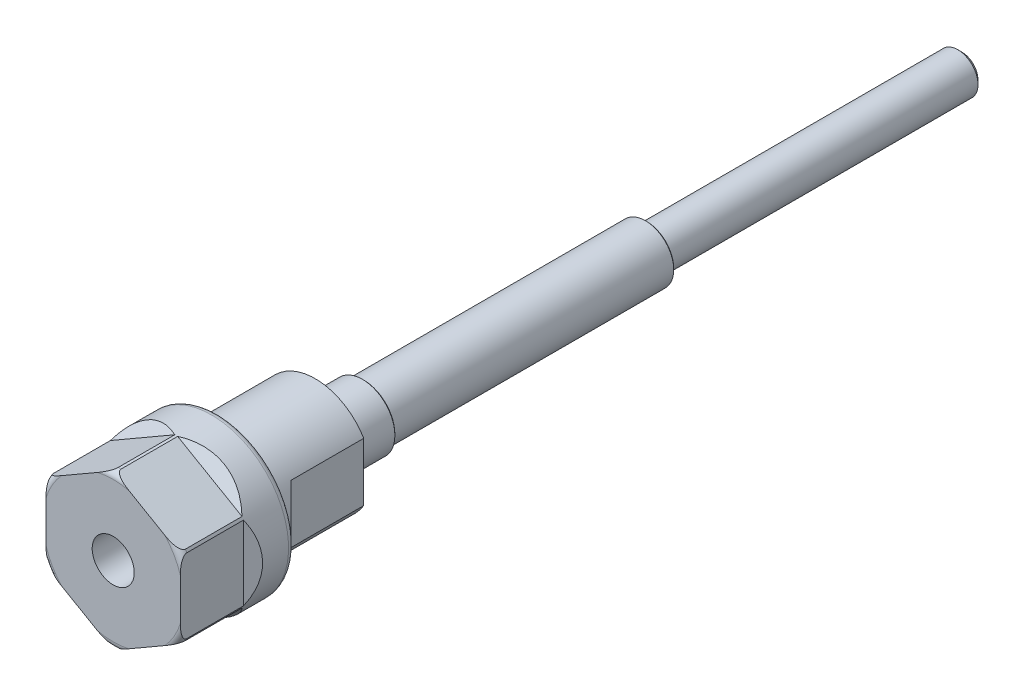
from build123d import *

# Parameters (mm, degrees)
ESQUISSE1_R         = 4
BOSS_EXTRU_1_DEPTH  = 80
SKETCH5_OUTSIDE_W   = 26.16
SKETCH5_OUTSIDE_H   = 26.16
SKETCH5_OUTSIDE_R   = 2.5
CUT_EXTRUDE6_DEPTH  = 39
CHAMFER4_SIZE       = 0.5
SKETCH6_OUTSIDE_W   = 26.16
SKETCH6_OUTSIDE_H   = 26.16
SKETCH6_OUTSIDE_R   = 3.5
CUT_EXTRUDE7_DEPTH  = 74
CHAMFER5_SIZE       = 0.15
ESQUISSE2_R         = 9.5
BOSS_EXTRU_2_DEPTH  = 25
CHANFREIN1_SIZE     = 1
SKETCH1_OUTSIDE_W   = 42.676
SKETCH1_OUTSIDE_H   = 42.676
SKETCH1_OUTSIDE_R   = 7
CUT_EXTRUDE1_DEPTH  = 12
SKETCH2_OUTSIDE_W   = 42.676
SKETCH2_OUTSIDE_H   = 42.676
SKETCH2_OUTSIDE_W_2 = 12
SKETCH2_OUTSIDE_H_2 = 19.946926602
CUT_EXTRUDE3_DEPTH  = 10
CHAMFER1_SIZE       = 1
FILLET1_R           = 0.8
SKETCH3_R           = 2.6
CUT_EXTRUDE4_DEPTH  = 12
SKETCH4_OUTSIDE_W   = 42.676
SKETCH4_OUTSIDE_H   = 42.676
CUT_EXTRUDE5_DEPTH  = 9
CHAMFER2_SIZE       = 1.2


# Some blends are built 0.0001 mm under size
with BuildPart() as part:
    # Esquisse1 → Boss.-Extru.1 (new body)
    with BuildSketch(Plane.XY):
        Circle(ESQUISSE1_R)
    extrude(amount=BOSS_EXTRU_1_DEPTH)

    # Sketch5 outside → Cut-Extrude6 (cut)
    with BuildSketch(Plane(origin=(0, 0, 0), x_dir=(-1, 0, 0), z_dir=(0, 0, -1))):
        Rectangle(SKETCH5_OUTSIDE_W, SKETCH5_OUTSIDE_H)
        Circle(SKETCH5_OUTSIDE_R, mode=Mode.SUBTRACT)
    extrude(amount=-CUT_EXTRUDE6_DEPTH, mode=Mode.SUBTRACT)

    # Chamfer4
    chamfer4_edges = [part.edges().sort_by_distance(p)[0] for p in [
        (2.5, 0, 0),
        (-4, 0, 39),
    ]]
    chamfer(chamfer4_edges, length=CHAMFER4_SIZE)

    # Sketch6 outside → Cut-Extrude7 (cut)
    with BuildSketch(Plane(origin=(0, 0, 0), x_dir=(-1, 0, 0), z_dir=(0, 0, -1))):
        Rectangle(SKETCH6_OUTSIDE_W, SKETCH6_OUTSIDE_H)
        with Locations(Location((0, 0, 0), (0, 0, 180))):
            Circle(SKETCH6_OUTSIDE_R, mode=Mode.SUBTRACT)
    extrude(amount=-CUT_EXTRUDE7_DEPTH, mode=Mode.SUBTRACT)

    # Chamfer5
    chamfer5_edges = [part.edges().sort_by_distance(p)[0] for p in [
        (-4, 0, 74),
        (-3.5, 0, 39),
    ]]
    chamfer(chamfer5_edges, length=CHAMFER5_SIZE)

    # Esquisse2 → Boss.-Extru.2 (add)
    with BuildSketch(Plane.XY.offset(80)):
        Circle(ESQUISSE2_R)
    extrude(amount=BOSS_EXTRU_2_DEPTH)

    # Chanfrein1
    chanfrein1_edges = [part.edges().sort_by_distance(p)[0] for p in [
        (-9.5, 0, 80),
    ]]
    chamfer(chanfrein1_edges, length=CHANFREIN1_SIZE)

    # Sketch1 outside → Cut-Extrude1 (cut)
    with BuildSketch(Plane(origin=(0, 0, 80), x_dir=(-1, 0, 0), z_dir=(0, 0, -1))):
        Rectangle(SKETCH1_OUTSIDE_W, SKETCH1_OUTSIDE_H)
        Circle(SKETCH1_OUTSIDE_R, mode=Mode.SUBTRACT)
    extrude(amount=-CUT_EXTRUDE1_DEPTH, mode=Mode.SUBTRACT)

    # Sketch2 outside → Cut-Extrude3 (cut)
    with BuildSketch(Plane(origin=(0, 0, 80), x_dir=(-1, 0, 0), z_dir=(0, 0, -1))):
        Rectangle(SKETCH2_OUTSIDE_W, SKETCH2_OUTSIDE_H)
        Rectangle(SKETCH2_OUTSIDE_W_2, SKETCH2_OUTSIDE_H_2, mode=Mode.SUBTRACT)
    extrude(amount=-CUT_EXTRUDE3_DEPTH, mode=Mode.SUBTRACT)

    # Chamfer1
    chamfer1_edges = [part.edges().sort_by_distance(p)[0] for p in [
        (-6, 0, 90),
        (6, 0, 90),
    ]]
    chamfer(chamfer1_edges, length=CHAMFER1_SIZE - 0.0001)  # a hair under: the kernel refuses the full size

    # Fillet1
    fillet1_edges = [part.edges().sort_by_distance(p)[0] for p in [
        (-9.5, 0, 105),
        (-9.5, 0, 92),
    ]]
    fillet(fillet1_edges, radius=FILLET1_R)

    # Sketch3 → Cut-Extrude4 (cut)
    with BuildSketch(Plane.XY.offset(105)):
        Circle(SKETCH3_R)
    extrude(amount=-CUT_EXTRUDE4_DEPTH, mode=Mode.SUBTRACT)

    # Sketch4 outside → Cut-Extrude5 (cut)
    with BuildSketch(Plane.XY.offset(105)):
        Rectangle(SKETCH4_OUTSIDE_W, SKETCH4_OUTSIDE_H)
        Polygon((0, 9.6), (-8.313843876, 4.8), (-8.313843876, -4.8), (0, -9.6), (8.313843876, -4.8), (8.313843876, 4.8), align=None, mode=Mode.SUBTRACT)
    extrude(amount=-CUT_EXTRUDE5_DEPTH, mode=Mode.SUBTRACT)

    # Chamfer2
    # the kernel refuses this chamfer: 1.2 mm, written as the material it adds along each edge
    with BuildSketch(Plane(origin=(10.810385156, 3.35862122, 96), x_dir=(-0.013747938305293243, -0.023812127644090277, 0.9996219169112968), z_dir=(-0.8660254037844388, 0.4999999999999998, 0))) as chamfer2_piece_1_section:
        Polygon((CHAMFER2_SIZE * 0.999621916911, CHAMFER2_SIZE * 0.0274958766106), (-CHAMFER2_SIZE * 0.0274958766106, CHAMFER2_SIZE * 0.999621916911), (0, 0), align=None)
    chamfer2_piece_1 = extrude(amount=15.365515119, mode=Mode.PRIVATE)
    chamfer2_piece_1 = chamfer2_piece_1 & Plane(origin=(0, 0, 96.431113377), x_dir=(1, 0, 0), z_dir=(0, 0, -1)) * Cylinder(9.5, 36, mode=Mode.PRIVATE)
    add(chamfer2_piece_1)
    with BuildSketch(Plane(origin=(8.313843876, -7.682757559, 96), x_dir=(0.9996219169112968, 0, -0.027495876610584506), z_dir=(0, 1, 0))) as chamfer2_piece_2_section:
        Polygon((CHAMFER2_SIZE * 0.999621916911, -CHAMFER2_SIZE * 0.0274958766106), (-CHAMFER2_SIZE * 0.0274958766106, -CHAMFER2_SIZE * 0.999621916911), (0, 0), align=None)
    chamfer2_piece_2 = extrude(amount=15.365515119, mode=Mode.PRIVATE)
    chamfer2_piece_2 = chamfer2_piece_2 & Plane(origin=(0, 0, 96.431113393), x_dir=(1, 0, 0), z_dir=(0, 0, -1)) * Cylinder(9.5, 36, mode=Mode.PRIVATE)
    add(chamfer2_piece_2)
    with BuildSketch(Plane(origin=(-2.496541279, -11.04137878, 96), x_dir=(-0.013747938305293143, 0.023812127644090086, 0.9996219169112968), z_dir=(0.8660254037844386, 0.5000000000000001, 0))) as chamfer2_piece_3_section:
        Polygon((CHAMFER2_SIZE * 0.999621916911, CHAMFER2_SIZE * 0.0274958766106), (-CHAMFER2_SIZE * 0.0274958766106, CHAMFER2_SIZE * 0.999621916911), (0, 0), align=None)
    chamfer2_piece_3 = extrude(amount=15.365515119, mode=Mode.PRIVATE)
    chamfer2_piece_3 = chamfer2_piece_3 & Plane(origin=(0, 0, 96.431113377), x_dir=(1, 0, 0), z_dir=(0, 0, -1)) * Cylinder(9.5, 36, mode=Mode.PRIVATE)
    add(chamfer2_piece_3)
    with BuildSketch(Plane(origin=(-10.810385156, -3.35862122, 96), x_dir=(0.013747938305293137, 0.023812127644090093, 0.9996219169112968), z_dir=(0.8660254037844387, -0.49999999999999983, 0))) as chamfer2_piece_4_section:
        Polygon((CHAMFER2_SIZE * 0.999621916911, CHAMFER2_SIZE * 0.0274958766106), (-CHAMFER2_SIZE * 0.0274958766106, CHAMFER2_SIZE * 0.999621916911), (0, 0), align=None)
    chamfer2_piece_4 = extrude(amount=15.365515119, mode=Mode.PRIVATE)
    chamfer2_piece_4 = chamfer2_piece_4 & Plane(origin=(0, 0, 96.431113377), x_dir=(1, 0, 0), z_dir=(0, 0, -1)) * Cylinder(9.5, 36, mode=Mode.PRIVATE)
    add(chamfer2_piece_4)
    with BuildSketch(Plane(origin=(-8.313843876, 7.682757559, 96), x_dir=(0.027495876610585904, 0, 0.9996219169112968), z_dir=(0, -1, 0))) as chamfer2_piece_5_section:
        Polygon((CHAMFER2_SIZE * 0.999621916911, CHAMFER2_SIZE * 0.0274958766106), (-CHAMFER2_SIZE * 0.0274958766106, CHAMFER2_SIZE * 0.999621916911), (0, 0), align=None)
    chamfer2_piece_5 = extrude(amount=15.365515119, mode=Mode.PRIVATE)
    chamfer2_piece_5 = chamfer2_piece_5 & Plane(origin=(0, 0, 96.431113377), x_dir=(1, 0, 0), z_dir=(0, 0, -1)) * Cylinder(9.5, 36, mode=Mode.PRIVATE)
    add(chamfer2_piece_5)
    with BuildSketch(Plane(origin=(2.496541279, 11.04137878, 96), x_dir=(0.013747938305292966, -0.023812127644089773, 0.9996219169112968), z_dir=(-0.8660254037844386, -0.5000000000000001, 0))) as chamfer2_piece_6_section:
        Polygon((CHAMFER2_SIZE * 0.999621916911, CHAMFER2_SIZE * 0.0274958766106), (-CHAMFER2_SIZE * 0.0274958766106, CHAMFER2_SIZE * 0.999621916911), (0, 0), align=None)
    chamfer2_piece_6 = extrude(amount=15.365515119, mode=Mode.PRIVATE)
    chamfer2_piece_6 = chamfer2_piece_6 & Plane(origin=(0, 0, 96.431113377), x_dir=(1, 0, 0), z_dir=(0, 0, -1)) * Cylinder(9.5, 36, mode=Mode.PRIVATE)
    add(chamfer2_piece_6)


solid = part.part
